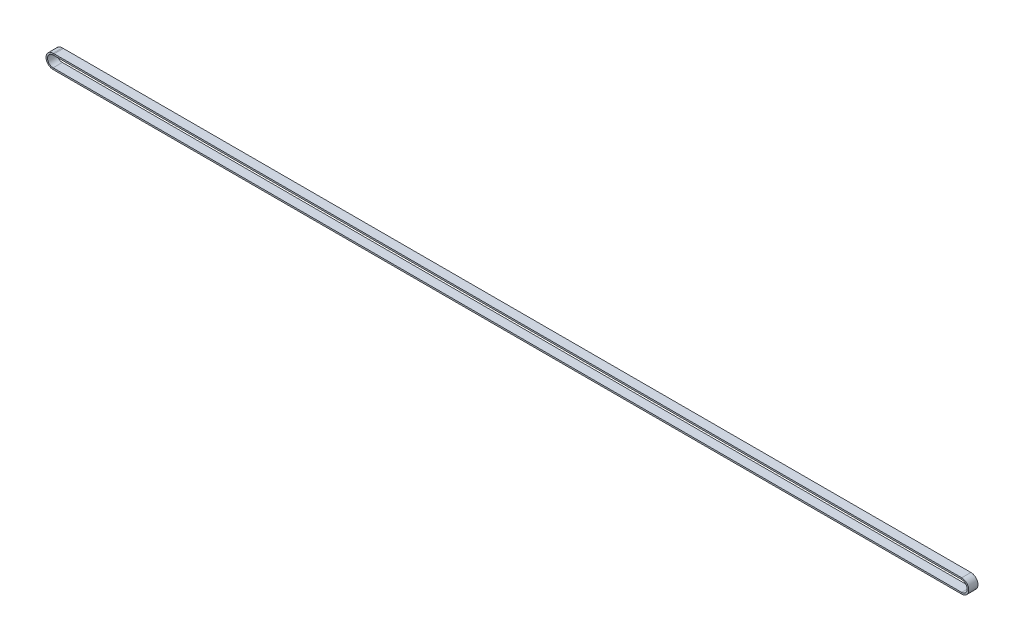
from build123d import *

# Parameters (mm, degrees)
SKETCH3_W = 9
SKETCH3_H = 1.5


with BuildPart() as part:
    # Sweep1: sweep along a path in Sketch2
    with BuildLine(Plane.XY.offset(-146.233366658)) as sweep1_path:
        Line((-1.000000001, 148.37934265), (883.52063783, 148.37934265))
        ThreePointArc((883.52063783, 148.37934265), (890.42063783, 141.47934265), (883.52063783, 134.57934265))
        Line((883.52063783, 134.57934265), (-1, 134.57934265))
        ThreePointArc((-1, 134.57934265), (-7.9, 141.479342649), (-1.000000001, 148.37934265))
    # Sketch3 → Sweep1 (sweep)
    with BuildSketch(Plane(origin=(0, 0, 0), x_dir=(0, 0, -1), z_dir=(1, 0, 0))):
        with Locations((141.733366658, 147.62934265)):
            Rectangle(SKETCH3_W, SKETCH3_H)
    sweep(path=sweep1_path.line)


solid = part.part
